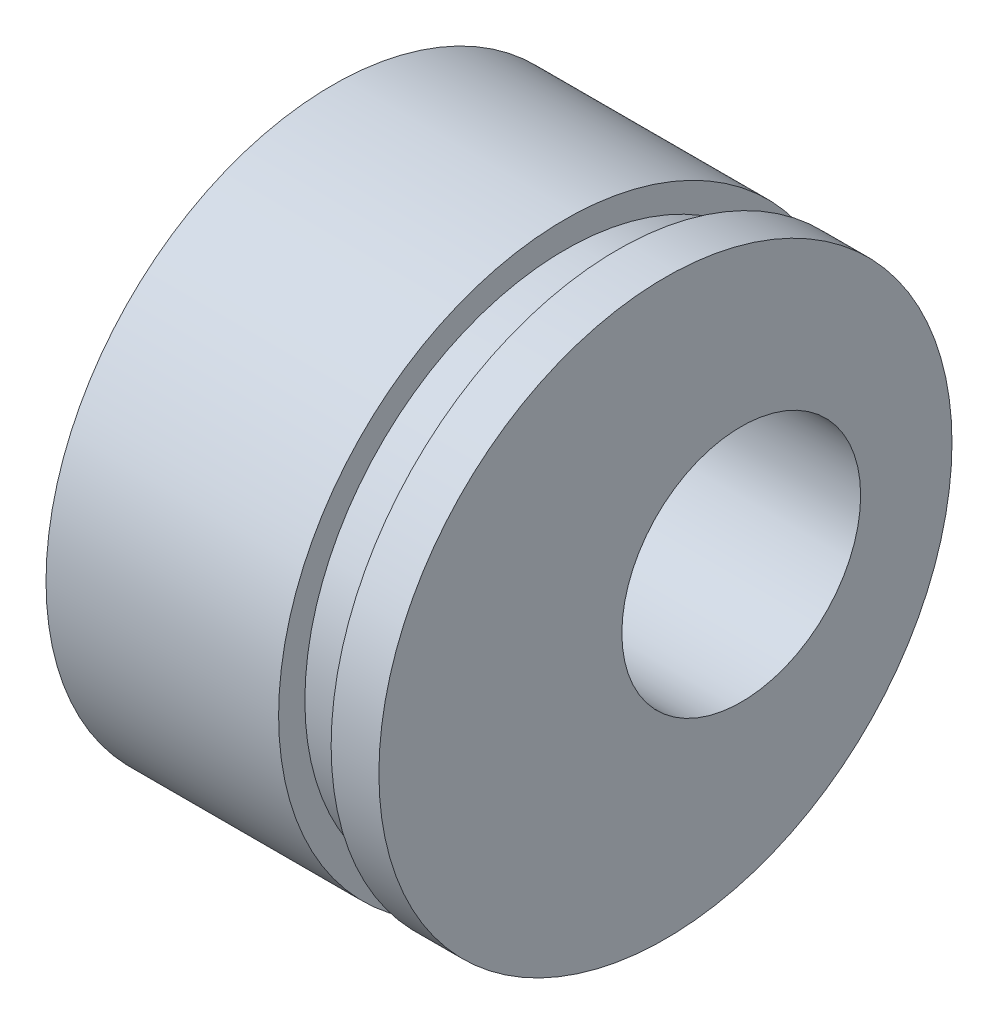
from build123d import *

# Parameters (mm, degrees)
SKETCH5_R          = 2.499999953
CUT_EXTRUDE1_DEPTH = 16.499061187


with BuildPart() as part:
    # Sketch3 → Revolve1 (revolve)
    with BuildSketch(Plane.XY):
        Polygon((12.969999968, 2.999999969), (12.969999968, 2.499999953), (12.969999968, 0), (5.999999938, 0), (5.999999938, 2.499999953), (5.999999938, 5.999999938), (9.969999872, 5.999999938), (10.86999985, 5.999999938), (10.86999985, 5.450000022), (11.969999936, 5.450000022), (11.969999936, 5.999999938), (12.969999968, 5.999999938), align=None)
    revolve(axis=Axis((5.999999938, 0, 0), (1, 0, 0)))

    # Sketch5 → Cut-Extrude1 (cut, through all)
    with BuildSketch(Plane(origin=(0, 0, 0), x_dir=(0, 0, -1), z_dir=(1, 0, 0))):
        with Locations((1.5875, 0)):
            Circle(SKETCH5_R)
    extrude(amount=CUT_EXTRUDE1_DEPTH, mode=Mode.SUBTRACT)


solid = part.part
